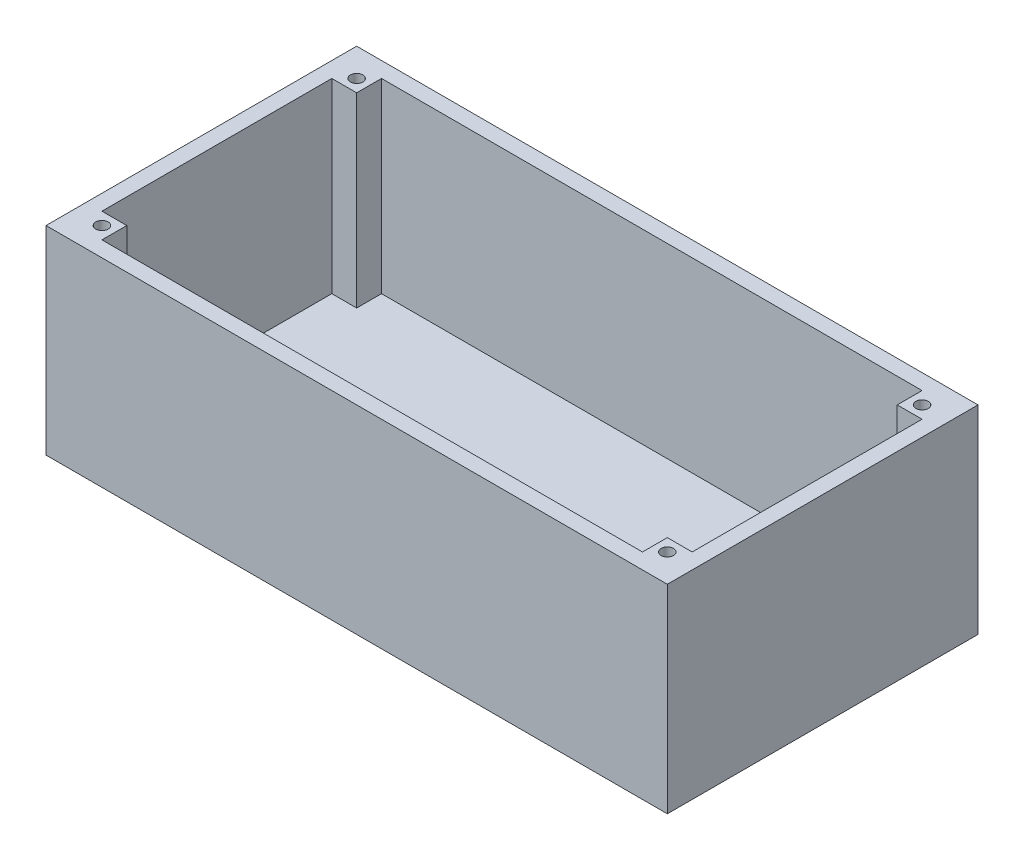
from build123d import *

# Parameters (mm, degrees)
SKETCH1_W           = 100
SKETCH1_H           = 50
BOSS_EXTRUDE1_DEPTH = 2
SKETCH3_W           = 100
SKETCH3_H           = 50
SKETCH3_R           = 1
BOSS_EXTRUDE2_DEPTH = 30


with BuildPart() as part:
    # Sketch1 → Boss-Extrude1 (new body)
    with BuildSketch(Plane(origin=(0, 0, 0), x_dir=(1, 0, 0), z_dir=(0, 1, 0))):
        with Locations((50, 25)):
            Rectangle(SKETCH1_W, SKETCH1_H)
    extrude(amount=BOSS_EXTRUDE1_DEPTH)

    # Sketch3 → Boss-Extrude2 (add)
    with BuildSketch(Plane(origin=(0, 2, 0), x_dir=(1, 0, 0), z_dir=(0, 1, 0))):
        with Locations((50, 25)):
            Rectangle(SKETCH3_W, SKETCH3_H)
        with Locations((4.5, 45.5)):
            Circle(SKETCH3_R, mode=Mode.SUBTRACT)
        with Locations((95.5, 45.5)):
            Circle(SKETCH3_R, mode=Mode.SUBTRACT)
        with Locations((95.5, 4.5)):
            Circle(SKETCH3_R, mode=Mode.SUBTRACT)
        with Locations((4.5, 4.5)):
            Circle(SKETCH3_R, mode=Mode.SUBTRACT)
        Polygon((6.5, 47.5), (93.5, 47.5), (93.5, 43.5), (97.5, 43.5), (97.5, 6.5), (93.5, 6.5), (93.5, 2.5), (6.5, 2.5), (6.5, 6.5), (2.5, 6.5), (2.5, 43.5), (6.5, 43.5), align=None, mode=Mode.SUBTRACT)
    extrude(amount=BOSS_EXTRUDE2_DEPTH)


solid = part.part
